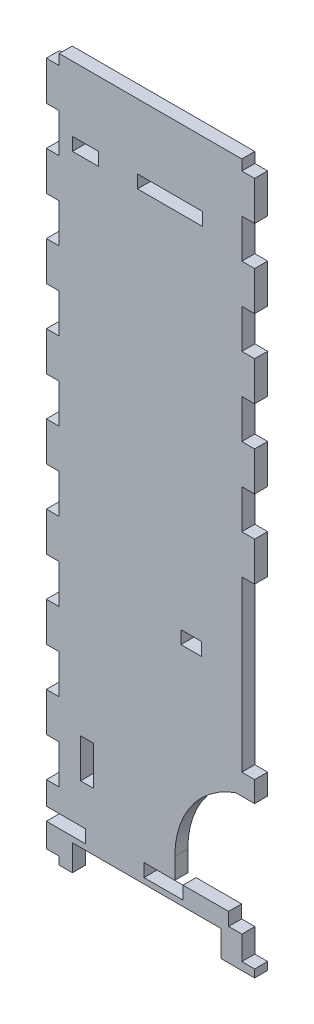
from build123d import *

# Parameters (mm, degrees)
BOSS_EXTRU_1_DEPTH      = 5
ESQUISSE2_W             = 8
ESQUISSE2_H             = 5
ESQUISSE2_W_2           = 15
ESQUISSE2_W_3           = 4.92
ESQUISSE2_H_2           = 65
ESQUISSE2_H_3           = 3
ESQUISSE2_H_4           = 15
ESQUISSE2_W_4           = 10
ESQUISSE2_W_5           = 25
ENL_V_MAT_EXTRU_1_DEPTH = 5
ESQUISSE3_W             = 7.280585373
ESQUISSE3_H             = 3.947256303
BOSS_EXTRU_2_DEPTH      = 5
ESQUISSE4_W             = 57
ESQUISSE4_H             = 10
ESQUISSE4_W_2           = 5
ESQUISSE4_H_2           = 15
ENL_V_MAT_EXTRU_2_DEPTH = 5


with BuildPart() as part:
    # Esquisse1 → Boss.-Extru.1 (new body)
    with BuildSketch(Plane.XY):
        with BuildLine():
            Line((0, 0), (80, 0))
            Line((80, 0), (80, 17.15))
            Line((80, 17.15), (49.330858803, 17.15))
            Line((49.330858803, 17.15), (49.330858803, 25.109342079))
            add(Edge.make_bspline(
                [(80, 59.779072791), (49.330858803, 55.600211761), (49.330858803, 25.109342079)],
                knots=[1.708281914, 1.708281914, 1.708281914, 3.141592654, 3.141592654, 3.141592654], degree=2, weights=[1, 0.754006918, 1]))
            Line((80, 59.779072791), (80, 270))
            Line((80, 270), (0, 270))
            Line((0, 270), (0, 0))
        make_face()
    extrude(amount=BOSS_EXTRU_1_DEPTH)

    # Esquisse2 → Enlèv. mat.-Extru.1 (cut)
    with BuildSketch(Plane.XY.offset(5)):
        with Locations((55.679721659, 99.250434868)):
            Rectangle(ESQUISSE2_W, ESQUISSE2_H)
        Polygon((75.08, 12.15), (70, 12.15), (70, 17.15), (80, 17.15), (80, 3), (75.08, 3), align=None)
        with Locations((45, 14.65)):
            Rectangle(ESQUISSE2_W_2, ESQUISSE2_H)
        with Locations((7.5, 14.65)):
            Rectangle(ESQUISSE2_W_2, ESQUISSE2_H)
        with Locations((77.54, 98.5)):
            Rectangle(ESQUISSE2_W_3, ESQUISSE2_H_2)
        with Locations((2.46, 1.5)):
            Rectangle(ESQUISSE2_W_3, ESQUISSE2_H_3)
        with Locations((77.54, 183.5)):
            Rectangle(ESQUISSE2_W_3, ESQUISSE2_H_4)
        with Locations((77.54, 153.5)):
            Rectangle(ESQUISSE2_W_3, ESQUISSE2_H_4)
        with Locations((77.54, 213.5)):
            Rectangle(ESQUISSE2_W_3, ESQUISSE2_H_4)
        with Locations((77.54, 243.5)):
            Rectangle(ESQUISSE2_W_3, ESQUISSE2_H_4)
        with Locations((77.54, 273.5)):
            Rectangle(ESQUISSE2_W_3, ESQUISSE2_H_4)
        with Locations((2.46, 273.5)):
            Rectangle(ESQUISSE2_W_3, ESQUISSE2_H_4)
        with Locations((2.46, 243.5)):
            Rectangle(ESQUISSE2_W_3, ESQUISSE2_H_4)
        with Locations((2.46, 213.5)):
            Rectangle(ESQUISSE2_W_3, ESQUISSE2_H_4)
        with Locations((2.46, 183.5)):
            Rectangle(ESQUISSE2_W_3, ESQUISSE2_H_4)
        with Locations((2.46, 153.5)):
            Rectangle(ESQUISSE2_W_3, ESQUISSE2_H_4)
        with Locations((2.46, 123.5)):
            Rectangle(ESQUISSE2_W_3, ESQUISSE2_H_4)
        with Locations((2.46, 93.5)):
            Rectangle(ESQUISSE2_W_3, ESQUISSE2_H_4)
        with Locations((2.46, 63.5)):
            Rectangle(ESQUISSE2_W_3, ESQUISSE2_H_4)
        with Locations((2.46, 33.5)):
            Rectangle(ESQUISSE2_W_3, ESQUISSE2_H_4)
        with Locations((15, 242.5)):
            Rectangle(ESQUISSE2_W_4, ESQUISSE2_H)
        with Locations((47.5, 242.5)):
            Rectangle(ESQUISSE2_W_5, ESQUISSE2_H)
    extrude(amount=-ENL_V_MAT_EXTRU_1_DEPTH, mode=Mode.SUBTRACT)

    # Esquisse3 → Boss.-Extru.2 (add)
    with BuildSketch(Plane(origin=(0, 0, 0), x_dir=(-1, 0, 0), z_dir=(0, 0, -1))):
        with Locations((-76.359707313, 59.973628152)):
            Rectangle(ESQUISSE3_W, ESQUISSE3_H)
    extrude(amount=-BOSS_EXTRU_2_DEPTH)

    # Esquisse4 → Enlèv. mat.-Extru.2 (cut)
    with BuildSketch(Plane.XY.offset(5)):
        with Locations((38.5, 5)):
            Rectangle(ESQUISSE4_W, ESQUISSE4_H)
        with Locations((15.628295523, 39.65)):
            Rectangle(ESQUISSE4_W_2, ESQUISSE4_H_2)
    extrude(amount=-ENL_V_MAT_EXTRU_2_DEPTH, mode=Mode.SUBTRACT)


solid = part.part
